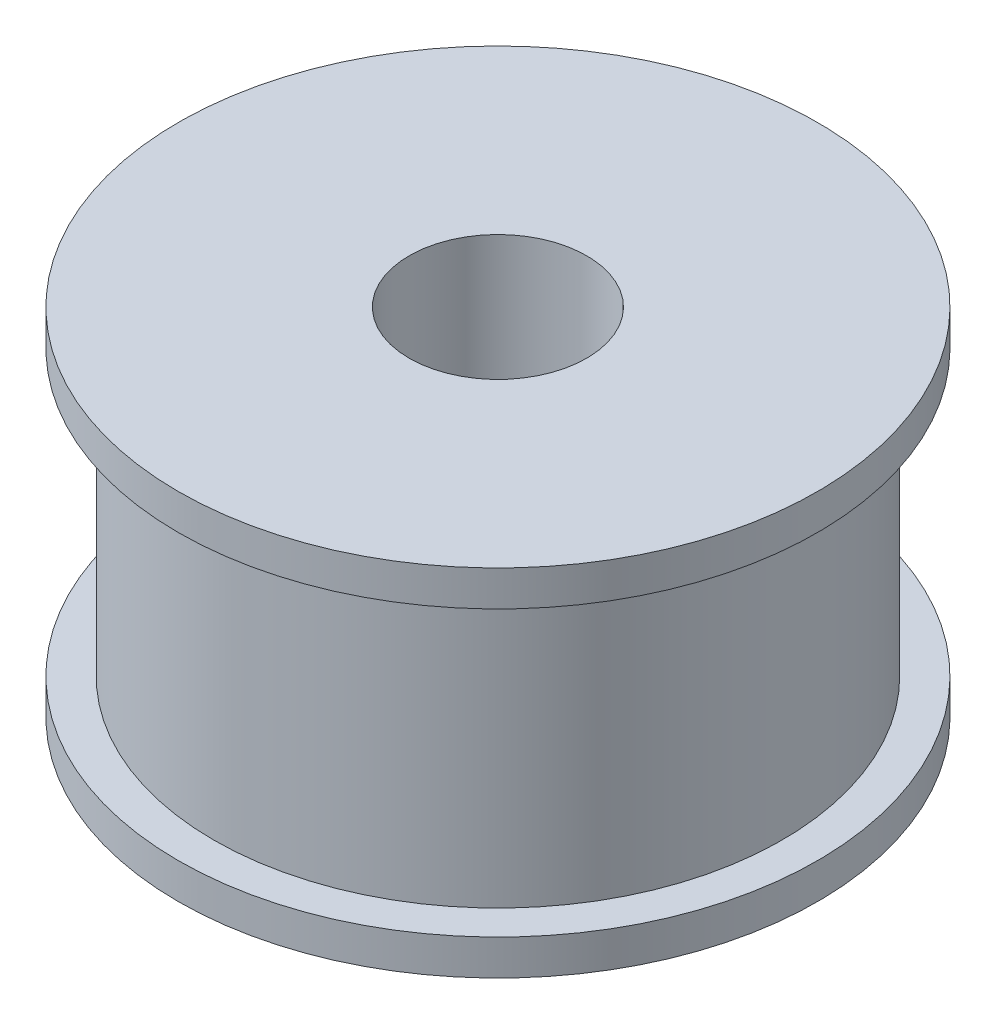
from build123d import *

# Parameters (mm, degrees)
SKETCH_1_R      = 9
SKETCH_1_R_2    = 2.5
EXTRUDE_1_DEPTH = 1
SKETCH_2_R      = 8
SKETCH_2_R_2    = 2.5
EXTRUDE_2_DEPTH = 8
SKETCH_3_R      = 9
SKETCH_3_R_2    = 2.5
EXTRUDE_3_DEPTH = 1


with BuildPart() as part:
    # Эскиз1 → Бобышка-Вытянуть1 (new body)
    with BuildSketch(Plane(origin=(0, 0, 0), x_dir=(1, 0, 0), z_dir=(0, 1, 0))):
        Circle(SKETCH_1_R)
        Circle(SKETCH_1_R_2, mode=Mode.SUBTRACT)
    extrude(amount=EXTRUDE_1_DEPTH)

    # Эскиз2 → Бобышка-Вытянуть2 (add)
    with BuildSketch(Plane(origin=(0, 1, 0), x_dir=(1, 0, 0), z_dir=(0, 1, 0))):
        Circle(SKETCH_2_R)
        Circle(SKETCH_2_R_2, mode=Mode.SUBTRACT)
    extrude(amount=EXTRUDE_2_DEPTH)

    # Эскиз3 → Бобышка-Вытянуть3 (add)
    with BuildSketch(Plane(origin=(0, 9, 0), x_dir=(1, 0, 0), z_dir=(0, 1, 0))):
        Circle(SKETCH_3_R)
        Circle(SKETCH_3_R_2, mode=Mode.SUBTRACT)
    extrude(amount=EXTRUDE_3_DEPTH)


solid = part.part
